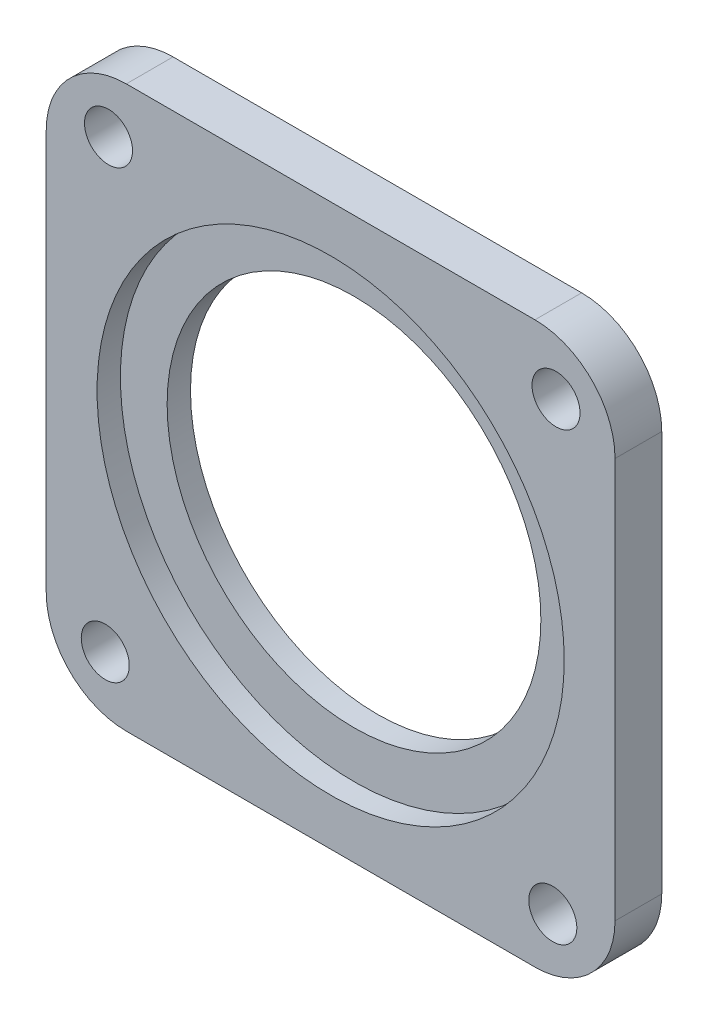
from build123d import *

# Parameters (mm, degrees)
SKETCH1_W            = 42.614634146
SKETCH1_H            = 42
SKETCH1_R            = 14
BOSS_EXTRUDE1_DEPTH  = 3.5
SKETCH2_R            = 17.5
CUT_EXTRUDE1_DEPTH   = 1.75
M3_CLEARANCE_HOLE1_D = 3.6
FILLET1_R            = 6


with BuildPart() as part:
    # Sketch1 → Boss-Extrude1 (new body)
    with BuildSketch(Plane.XY):
        Rectangle(SKETCH1_W, SKETCH1_H)
        Circle(SKETCH1_R, mode=Mode.SUBTRACT)
    extrude(amount=BOSS_EXTRUDE1_DEPTH)

    # Sketch2 → Cut-Extrude1 (cut)
    with BuildSketch(Plane.XY.offset(3.5)):
        Circle(SKETCH2_R)
    extrude(amount=-CUT_EXTRUDE1_DEPTH, mode=Mode.SUBTRACT)

    # M3 Clearance Hole1 (through all)
    with Locations(Plane(origin=(0, 0, 0), x_dir=(-1, 0, 0), z_dir=(0, 0, -1))):
        with Locations((-16.642079068, -16.885621688), (-16.885621688, 16.642079068), (16.642079068, 16.885621688), (16.885621688, -16.642079068)):
            Hole(M3_CLEARANCE_HOLE1_D / 2)

    # Fillet1
    fillet1_edges = [part.edges().sort_by_distance(p)[0] for p in [
        (-21.307317073, 21, 1.75),
        (-21.307317073, -21, 1.75),
        (21.307317073, -21, 1.75),
        (21.307317073, 21, 1.75),
    ]]
    fillet(fillet1_edges, radius=FILLET1_R)


solid = part.part
